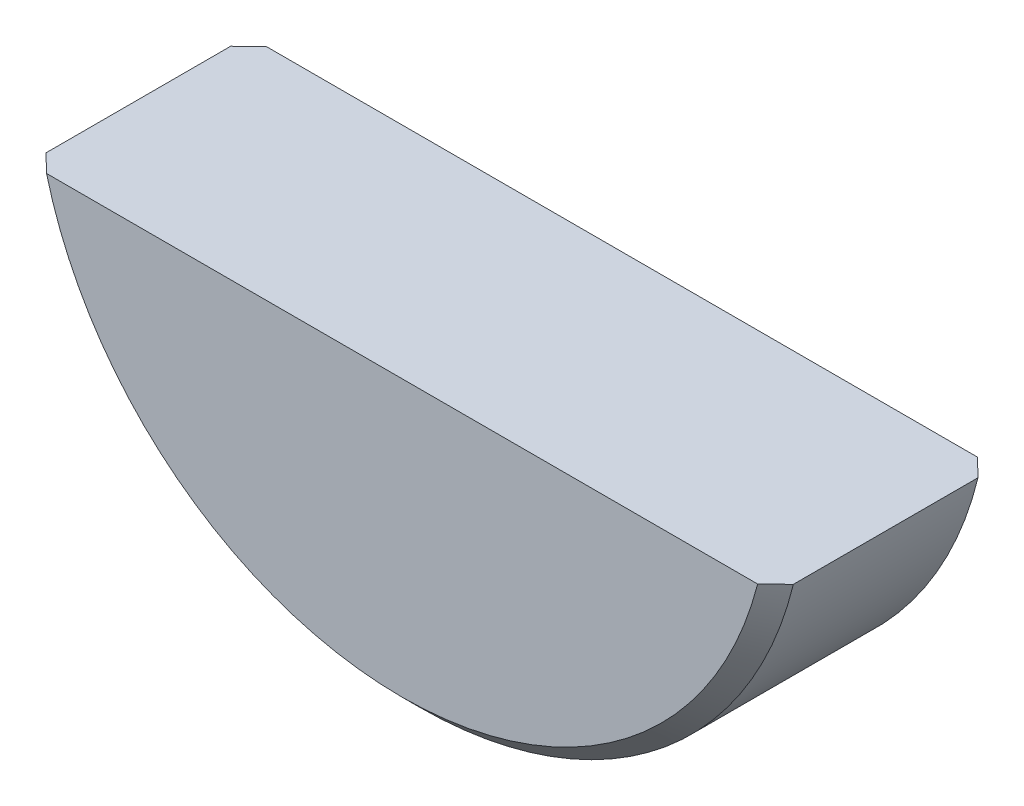
from build123d import *

# Parameters (mm, degrees)
BASEKEY_DEPTH = 1
CHAMFER1_SIZE = 0.16


with BuildPart() as part:
    # Sketch1 → BaseKey (new, symmetric)
    with BuildSketch(Plane.XY):
        with BuildLine():
            Line((-3.4, -0.830662386), (3.4, -0.830662386))
            ThreePointArc((3.4, -0.830662386), (0, -3.5), (-3.4, -0.830662386))
        make_face()
    extrude(amount=BASEKEY_DEPTH, both=True)

    # Chamfer1
    chamfer1_edges = [part.edges().sort_by_distance(p)[0] for p in [
        (0, -3.5, 1),
        (0, -3.5, -1),
    ]]
    chamfer(chamfer1_edges, length=CHAMFER1_SIZE)


solid = part.part
